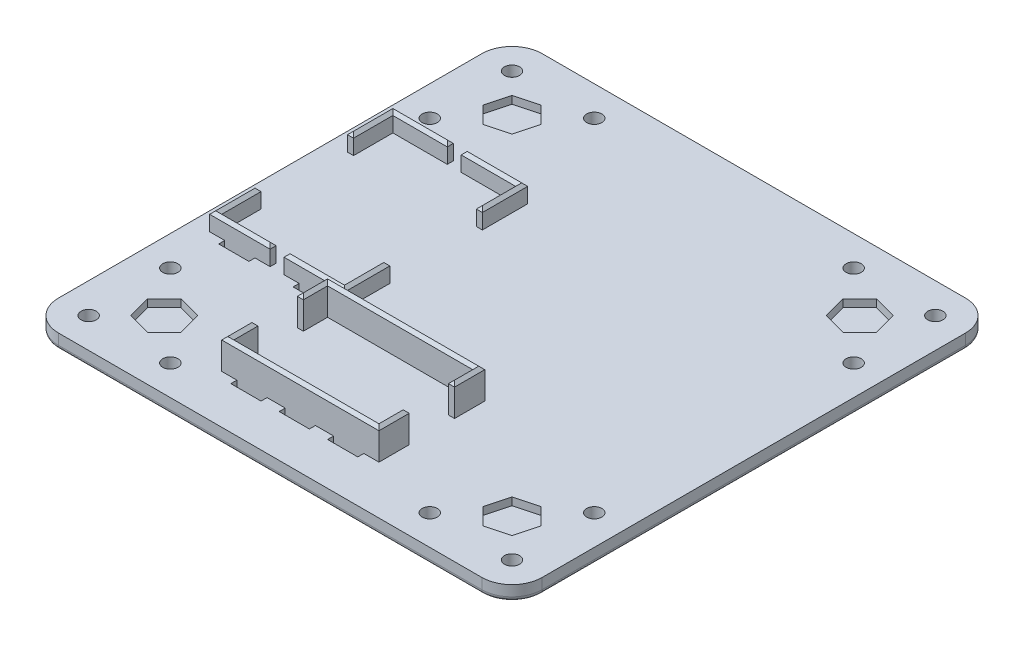
from build123d import *

# Parameters (mm, degrees)
SKETCH1_W           = 203.2
SKETCH1_H           = 203.2
BOSS_EXTRUDE1_DEPTH = 6.35
FILLET1_R           = 12.7
SKETCH2_R           = 3.175
CUT_EXTRUDE1_DEPTH  = 288.438345563
CUT_EXTRUDE2_DEPTH  = 3.175
BOSS_EXTRUDE2_DEPTH = 7.62
CHAMFER1_SIZE       = 1.27
BOSS_EXTRUDE3_DEPTH = 12.7
CHAMFER2_SIZE       = 1.27
FILLET2_R           = 1.905
SKETCH28_R          = 3.175
CUT_EXTRUDE3_DEPTH  = 288.648692054
SKETCH29_W          = 12.7
SKETCH29_H          = 2.54
CUT_EXTRUDE4_DEPTH  = 288.648692054


with BuildPart() as part:
    # Sketch1 → Boss-Extrude1 (new body)
    with BuildSketch(Plane(origin=(0, 0, 0), x_dir=(1, 0, 0), z_dir=(0, 1, 0))):
        with Locations((101.6, 101.6)):
            Rectangle(SKETCH1_W, SKETCH1_H)
    extrude(amount=BOSS_EXTRUDE1_DEPTH)

    # Fillet1
    fillet1_edges = [part.edges().sort_by_distance(p)[0] for p in [
        (0, 3.175, -203.2),
        (203.2, 3.175, -203.2),
        (203.2, 3.175, 0),
        (0, 3.175, 0),
    ]]
    fillet(fillet1_edges, radius=FILLET1_R)

    # Sketch2 → Cut-Extrude1 (cut, through all)
    with BuildSketch(Plane.XZ):
        with Locations(Location((12.7, -12.7, 0), (0, 0, 270))):
            Circle(SKETCH2_R)
        with Locations(Location((190.5, -12.7, 0), (0, 0, 270))):
            Circle(SKETCH2_R)
        with Locations(Location((190.5, -190.5, 0), (0, 0, 270))):
            Circle(SKETCH2_R)
        with Locations(Location((12.7, -190.5, 0), (0, 0, 270))):
            Circle(SKETCH2_R)
    extrude(amount=-CUT_EXTRUDE1_DEPTH, mode=Mode.SUBTRACT)

    # Sketch22 → Cut-Extrude2 (cut)
    with BuildSketch(Plane(origin=(0, 6.35, 0), x_dir=(1, 0, 0), z_dir=(0, 1, 0))):
        Polygon((181.654219065, 181.654219065), (172.052127253, 184.227091812), (165.022908188, 177.197872747), (167.595780935, 167.595780935), (177.197872747, 165.022908188), (184.227091812, 172.052127253), align=None)
        Polygon((18.972908188, 172.052127253), (21.545780935, 181.654219065), (31.147872747, 184.227091812), (38.177091812, 177.197872747), (35.604219065, 167.595780935), (26.002127253, 165.022908188), align=None)
        Polygon((184.227091812, 31.147872747), (181.654219065, 21.545780935), (172.052127253, 18.972908188), (165.022908188, 26.002127253), (167.595780935, 35.604219065), (177.197872747, 38.177091812), align=None)
        Polygon((21.545780935, 21.545780935), (31.147872747, 18.972908188), (38.177091812, 26.002127253), (35.604219065, 35.604219065), (26.002127253, 38.177091812), (18.972908188, 31.147872747), align=None)
    extrude(amount=-CUT_EXTRUDE2_DEPTH, mode=Mode.SUBTRACT)

    # Sketch23 → Boss-Extrude2 (add)
    with BuildSketch(Plane(origin=(0, 6.35, 0), x_dir=(1, 0, 0), z_dir=(0, 1, 0))):
        Polygon((64.262, 145.542), (38.862, 145.542), (38.862, 143.002), (61.722, 143.002), (61.722, 126.492), (64.262, 126.492), align=None)
        Polygon((64.262, 68.58), (38.862, 68.58), (38.862, 71.12), (61.722, 71.12), (61.722, 87.63), (64.262, 87.63), align=None)
        Polygon((7.62, 145.542), (7.62, 126.492), (10.16, 126.492), (10.16, 143.002), (33.02, 143.002), (33.02, 145.542), align=None)
        Polygon((10.16, 87.63), (7.62, 87.63), (7.62, 68.58), (33.02, 68.58), (33.02, 71.12), (10.16, 71.12), align=None)
    extrude(amount=BOSS_EXTRUDE2_DEPTH)

    # Chamfer1
    chamfer1_edges = [part.edges().sort_by_distance(p)[0] for p in [
        (64.262, 13.97, -136.017),
        (51.562, 13.97, -145.542),
        (38.862, 13.97, -144.272),
        (50.292, 13.97, -143.002),
        (61.722, 13.97, -134.747),
        (62.992, 13.97, -126.492),
        (7.62, 13.97, -78.105),
        (20.32, 13.97, -68.58),
        (33.02, 13.97, -69.85),
        (21.59, 13.97, -71.12),
        (10.16, 13.97, -79.375),
        (8.89, 13.97, -87.63),
        (64.262, 13.97, -78.105),
        (62.992, 13.97, -87.63),
        (61.722, 13.97, -79.375),
        (50.292, 13.97, -71.12),
        (38.862, 13.97, -69.85),
        (51.562, 13.97, -68.58),
        (20.32, 13.97, -145.542),
        (7.62, 13.97, -136.017),
        (8.89, 13.97, -126.492),
        (10.16, 13.97, -134.747),
        (21.59, 13.97, -143.002),
        (33.02, 13.97, -144.272),
    ]]
    chamfer(chamfer1_edges, length=CHAMFER1_SIZE - 0.0001)  # a hair under: the kernel refuses the full size

    # Sketch24 → Boss-Extrude3 (add)
    with BuildSketch(Plane(origin=(0, 6.35, 0), x_dir=(1, 0, 0), z_dir=(0, 1, 0))):
        Polygon((124.46, 62.23), (63.5, 62.23), (63.5, 52.07), (60.96, 52.07), (60.96, 64.77), (127, 64.77), (127, 52.07), (124.46, 52.07), align=None)
        Polygon((124.46, 22.86), (63.5, 22.86), (63.5, 33.02), (60.96, 33.02), (60.96, 20.32), (127, 20.32), (127, 33.02), (124.46, 33.02), align=None)
    extrude(amount=BOSS_EXTRUDE3_DEPTH)

    # Chamfer2
    chamfer2_edges = [part.edges().sort_by_distance(p)[0] for p in [
        (124.46, 19.05, -57.15),
        (125.73, 19.05, -52.07),
        (127, 19.05, -58.42),
        (93.98, 19.05, -64.77),
        (60.96, 19.05, -58.42),
        (62.23, 19.05, -52.07),
        (63.5, 19.05, -57.15),
        (93.98, 19.05, -62.23),
        (63.5, 19.05, -27.94),
        (62.23, 19.05, -33.02),
        (60.96, 19.05, -26.67),
        (93.98, 19.05, -20.32),
        (127, 19.05, -26.67),
        (125.73, 19.05, -33.02),
        (124.46, 19.05, -27.94),
        (93.98, 19.05, -22.86),
    ]]
    chamfer(chamfer2_edges, length=CHAMFER2_SIZE - 0.0001)  # a hair under: the kernel refuses the full size

    # Fillet2
    fillet2_edges = [part.edges().sort_by_distance(p)[0] for p in [
        (0, 0, -101.6),
        (101.6, 0, -203.2),
        (203.2, 0, -101.6),
        (101.6, 0, 0),
        (199.480256121, 0, -199.480256121),
        (199.480256121, 0, -3.719743879),
        (3.719743879, 0, -3.719743879),
        (3.719743879, 0, -199.480256121),
        (12.7, 0, -187.325),
        (190.5, 0, -187.325),
        (190.5, 0, -9.525),
        (12.7, 0, -9.525),
    ]]
    fillet(fillet2_edges, radius=FILLET2_R)

    # Sketch28 → Cut-Extrude3 (cut, through all)
    with BuildSketch(Plane(origin=(0, 6.35, 0), x_dir=(1, 0, 0), z_dir=(0, 1, 0))):
        with Locations(Location((47.117, 190.627, 0), (0, 0, 270))):
            Circle(SKETCH28_R)
        with Locations(Location((156.083, 190.627, 0), (0, 0, 270))):
            Circle(SKETCH28_R)
        with Locations(Location((190.627, 156.083, 0), (0, 0, 270))):
            Circle(SKETCH28_R)
        with Locations(Location((190.627, 47.117, 0), (0, 0, 270))):
            Circle(SKETCH28_R)
        with Locations(Location((156.083, 12.573, 0), (0, 0, 270))):
            Circle(SKETCH28_R)
        with Locations(Location((47.117, 12.573, 0), (0, 0, 270))):
            Circle(SKETCH28_R)
        with Locations(Location((12.573, 156.083, 0), (0, 0, 270))):
            Circle(SKETCH28_R)
        with Locations(Location((12.573, 47.117, 0), (0, 0, 270))):
            Circle(SKETCH28_R)
    extrude(amount=-CUT_EXTRUDE3_DEPTH, mode=Mode.SUBTRACT)

    # Sketch29 → Cut-Extrude4 (cut, through all)
    with BuildSketch(Plane(origin=(0, 6.35, 0), x_dir=(1, 0, 0), z_dir=(0, 1, 0))):
        with Locations((20.32, 146.812)):
            Rectangle(SKETCH29_W, SKETCH29_H)
        with Locations((51.562, 146.812)):
            Rectangle(SKETCH29_W, SKETCH29_H)
        with Locations((73.66, 66.04)):
            Rectangle(SKETCH29_W, SKETCH29_H)
        with Locations((114.3, 66.04)):
            Rectangle(SKETCH29_W, SKETCH29_H)
        with Locations((73.66, 19.05)):
            Rectangle(SKETCH29_W, SKETCH29_H)
        with Locations((114.3, 19.05)):
            Rectangle(SKETCH29_W, SKETCH29_H)
        with Locations((51.562, 67.31)):
            Rectangle(SKETCH29_W, SKETCH29_H)
        with Locations((20.32, 67.31)):
            Rectangle(SKETCH29_W, SKETCH29_H)
        with Locations((93.98, 66.04)):
            Rectangle(SKETCH29_W, SKETCH29_H)
        with Locations((93.98, 19.05)):
            Rectangle(SKETCH29_W, SKETCH29_H)
    extrude(amount=-CUT_EXTRUDE4_DEPTH, mode=Mode.SUBTRACT)


solid = part.part
